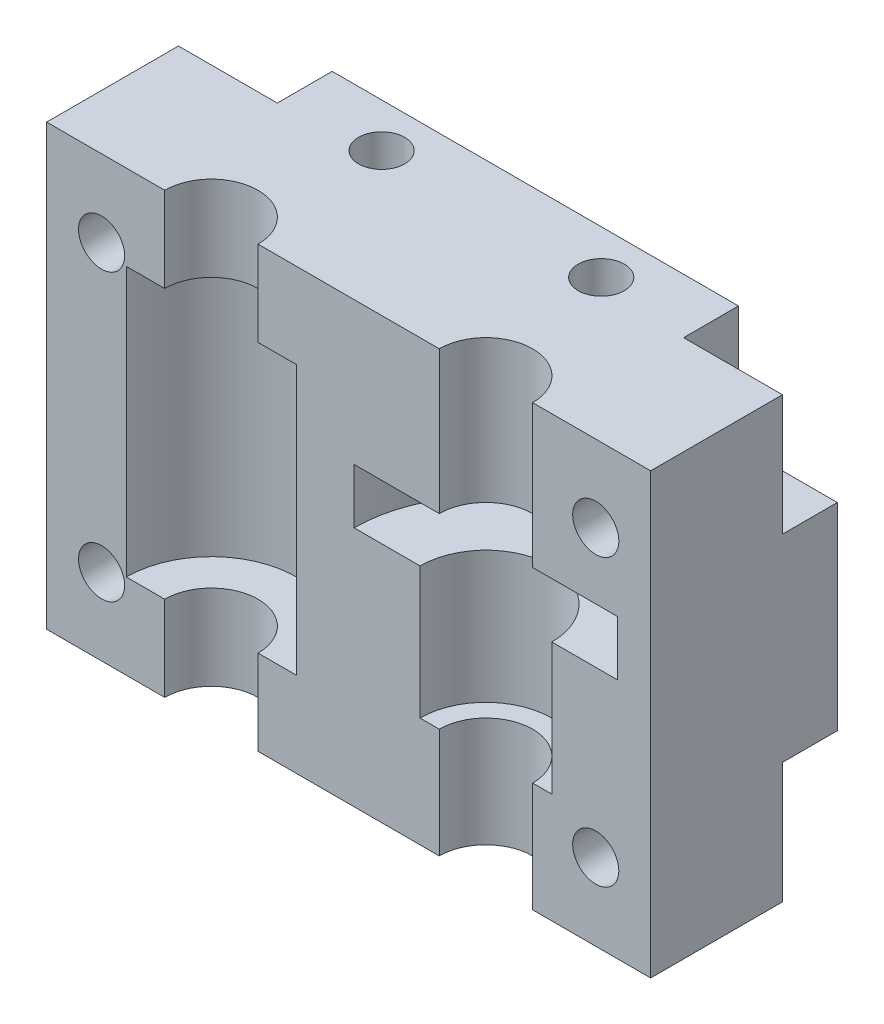
from build123d import *
from build123d.topology import SkipClean

# Parameters (mm, degrees)
ESQUISSE1_W                  = 55
ESQUISSE1_H                  = 45
BOSS_EXTRU_1_DEPTH           = 12
ESQUISSE2_R                  = 4.25
ENL_V_MAT_EXTRU_1_DEPTH      = 55.085580333
ENL_V_MAT_EXTRU_2_DEPTH      = 12.25
ENL_V_MAT_EXTRU_2_DEPTH_BACK = 12.25
ESQUISSE3_R                  = 7.75
ESQUISSE9_W                  = 61.062756781
ESQUISSE9_H                  = 12.22812859
ESQUISSE9_W_2                = 59.427147224
ESQUISSE9_H_2                = 8.100161614
ENL_V_MAT_EXTRU_7_DEPTH      = 31
SKETCH1_W                    = 55
SKETCH1_H                    = 36
BOSS_EXTRUDE1_DEPTH          = 5
SKETCH2_R                    = 2.1
CUT_EXTRUDE1_DEPTH           = 38.003378224
SKETCH3_R                    = 4
CUT_EXTRUDE2_DEPTH           = 10
CUT_EXTRUDE3_DEPTH           = 5
SKETCH5_R                    = 2.1
CUT_EXTRUDE4_DEPTH           = 10
BOSS_EXTRUDE4_START          = 2
SKETCH7_R                    = 2.1
BOSS_EXTRUDE4_DEPTH          = 2
SKETCH8_R                    = 2.1
BOSS_EXTRUDE5_DEPTH          = 2
SKETCH9_W                    = 7
SKETCH9_H                    = 3.2
CUT_EXTRUDE6_DEPTH           = 8
ESQUISSE12_R                 = 6
ENL_V_MAT_EXTRU_9_DEPTH      = 12
ESQUISSE13_R                 = 12
ENL_V_MAT_EXTRU_10_DEPTH     = 5


with BuildPart() as part:
    # Esquisse1 → Boss.-Extru.1 (new body)
    with BuildSketch(Plane.XY):
        Rectangle(ESQUISSE1_W, ESQUISSE1_H)
    extrude(amount=BOSS_EXTRU_1_DEPTH)

    # Esquisse2 → Enlèv. mat.-Extru.1 (cut, through all)
    with BuildSketch(Plane(origin=(0, 22.5, 0), x_dir=(1, 0, 0), z_dir=(0, 1, 0))):
        with Locations((-12.5, -12)):
            Circle(ESQUISSE2_R)
        with Locations((12.5, -12)):
            Circle(ESQUISSE2_R)
    extrude(amount=-ENL_V_MAT_EXTRU_1_DEPTH, mode=Mode.SUBTRACT)

    # Esquisse3 → Enlèv. mat.-Extru.2 (cut, two sides: drawn at the far end of the back side and taken through both)
    with BuildSketch(Plane(origin=(0, 0, 0), x_dir=(1, 0, 0), z_dir=(0, 1, 0)).offset(-ENL_V_MAT_EXTRU_2_DEPTH_BACK)):
        with Locations((-12.5, -12)):
            Circle(ESQUISSE3_R)
    extrude(amount=ENL_V_MAT_EXTRU_2_DEPTH + ENL_V_MAT_EXTRU_2_DEPTH_BACK, mode=Mode.SUBTRACT)

    # Esquisse9 → Enlèv. mat.-Extru.7 (cut)
    with BuildSketch(Plane.XY.offset(12)):
        with Locations((-0.389430846, -24.114064295)):
            Rectangle(ESQUISSE9_W, ESQUISSE9_H)
        with Locations((1.674552641, 22.050080807)):
            Rectangle(ESQUISSE9_W_2, ESQUISSE9_H_2)
    extrude(amount=-ENL_V_MAT_EXTRU_7_DEPTH, mode=Mode.SUBTRACT)

    # Sketch1 → Boss-Extrude1 (add)
    with BuildSketch(Plane(origin=(0, 0, 0), x_dir=(-1, 0, 0), z_dir=(0, 0, -1))):
        Rectangle(SKETCH1_W, SKETCH1_H)
    extrude(amount=BOSS_EXTRUDE1_DEPTH)

    # Sketch2 → Cut-Extrude1 (cut, through all)
    with BuildSketch(Plane.XY.offset(12)):
        with Locations((-22.5, 13)):
            Circle(SKETCH2_R)
        with Locations((22.5, 13)):
            Circle(SKETCH2_R)
        with Locations((22.5, -13)):
            Circle(SKETCH2_R)
        with Locations((-22.5, -13)):
            Circle(SKETCH2_R)
    extrude(amount=-CUT_EXTRUDE1_DEPTH, mode=Mode.SUBTRACT)

    # Sketch3 → Cut-Extrude2 (cut)
    with BuildSketch(Plane(origin=(0, 0, -5), x_dir=(-1, 0, 0), z_dir=(0, 0, -1))):
        with Locations((-22.5, 13)):
            Circle(SKETCH3_R)
        with Locations((22.5, 13)):
            Circle(SKETCH3_R)
        with Locations((22.5, -13)):
            Circle(SKETCH3_R)
        with Locations((-22.5, -13)):
            Circle(SKETCH3_R)
    extrude(amount=-CUT_EXTRUDE2_DEPTH, mode=Mode.SUBTRACT)

    # Sketch4 → Cut-Extrude3 (cut)
    with BuildSketch(Plane(origin=(0, 0, -5), x_dir=(-1, 0, 0), z_dir=(0, 0, -1))):
        with BuildLine():
            Line((-18.5, 13), (-18.5, 18))
            Line((-18.5, 18), (-27.5, 18))
            Line((-27.5, 18), (-27.5, 9))
            Line((-27.5, 9), (-22.5, 9))
            ThreePointArc((-22.5, 9), (-25.328427125, 15.828427125), (-18.5, 13))
        make_face()
        with BuildLine():
            Line((-22.5, -9), (-27.5, -9))
            Line((-27.5, -9), (-27.5, -18))
            Line((-27.5, -18), (-18.5, -18))
            Line((-18.5, -18), (-18.5, -13))
            ThreePointArc((-18.5, -13), (-25.328427125, -15.828427125), (-22.5, -9))
        make_face()
        with BuildLine():
            Line((27.5, -18), (27.5, -9))
            Line((27.5, -9), (22.5, -9))
            ThreePointArc((22.5, -9), (25.328427125, -15.828427125), (18.5, -13))
            Line((18.5, -13), (18.5, -18))
            Line((18.5, -18), (27.5, -18))
        make_face()
        with BuildLine():
            Line((27.5, 18), (18.5, 18))
            Line((18.5, 18), (18.5, 13))
            ThreePointArc((18.5, 13), (25.328427125, 15.828427125), (22.5, 9))
            Line((22.5, 9), (27.5, 9))
            Line((27.5, 9), (27.5, 18))
        make_face()
    extrude(amount=-CUT_EXTRUDE3_DEPTH, mode=Mode.SUBTRACT)

    # Sketch5 → Cut-Extrude4 (cut)
    with BuildSketch(Plane(origin=(0, 18, 0), x_dir=(1, 0, 0), z_dir=(0, 1, 0))):
        with Locations((-10, 1)):
            Circle(SKETCH5_R)
        with Locations((10, 1)):
            Circle(SKETCH5_R)
    extrude(amount=-CUT_EXTRUDE4_DEPTH, mode=Mode.SUBTRACT)

    # Sketch7 → Boss-Extrude4 (add)
    with SkipClean():  # the faces are left unmerged after this step: merging them gives an invalid solid
        with BuildSketch(Plane(origin=(0, 18, 0), x_dir=(1, 0, 0), z_dir=(0, 1, 0)).offset(BOSS_EXTRUDE4_START)):
            with BuildLine():
                Line((18.5, 5), (-18.5, 5))
                Line((-18.5, 5), (-18.5, 0))
                Line((-18.5, 0), (-27.5, 0))
                Line((-27.5, 0), (-27.5, -12))
                Line((-27.5, -12), (-16.75, -12))
                ThreePointArc((-16.75, -12), (-12.5, -7.75), (-8.25, -12))
                Line((-8.25, -12), (8.25, -12))
                ThreePointArc((8.25, -12), (12.5, -7.75), (16.75, -12))
                Line((16.75, -12), (27.5, -12))
                Line((27.5, -12), (27.5, 0))
                Line((27.5, 0), (18.5, 0))
                Line((18.5, 0), (18.5, 5))
            make_face()
            with Locations((10, 1)):
                Circle(SKETCH7_R, mode=Mode.SUBTRACT)
            with Locations((-10, 1)):
                Circle(SKETCH7_R, mode=Mode.SUBTRACT)
        extrude(amount=-BOSS_EXTRUDE4_DEPTH)
    add(part.part.scale(1), mode=Mode.REPLACE)  # the faces are merged on a copy

    # Sketch8 → Boss-Extrude5 (add)
    with BuildSketch(Plane.XZ.offset(18)):
        with BuildLine():
            Line((-27.5, 0), (-18.5, 0))
            Line((-18.5, 0), (-18.5, -5))
            Line((-18.5, -5), (18.5, -5))
            Line((18.5, -5), (18.5, 0))
            Line((18.5, 0), (27.5, 0))
            Line((27.5, 0), (27.5, 12))
            Line((27.5, 12), (16.75, 12))
            ThreePointArc((16.75, 12), (12.5, 7.75), (8.25, 12))
            Line((8.25, 12), (-8.25, 12))
            ThreePointArc((-8.25, 12), (-12.5, 7.75), (-16.75, 12))
            Line((-16.75, 12), (-27.5, 12))
            Line((-27.5, 12), (-27.5, 0))
        make_face()
        with Locations((10, -1)):
            Circle(SKETCH8_R, mode=Mode.SUBTRACT)
        with Locations((-10, -1)):
            Circle(SKETCH8_R, mode=Mode.SUBTRACT)
    extrude(amount=BOSS_EXTRUDE5_DEPTH)

    # Sketch9 → Cut-Extrude6 (cut)
    with BuildSketch(Plane(origin=(0, 0, -5), x_dir=(-1, 0, 0), z_dir=(0, 0, -1))):
        with Locations((-10, 14.4)):
            Rectangle(SKETCH9_W, SKETCH9_H)
        with Locations((10, 14.4)):
            Rectangle(SKETCH9_W, SKETCH9_H)
        with Locations((10, -14.4)):
            Rectangle(SKETCH9_W, SKETCH9_H)
        with Locations((-10, -14.4)):
            Rectangle(SKETCH9_W, SKETCH9_H)
    extrude(amount=-CUT_EXTRUDE6_DEPTH, mode=Mode.SUBTRACT)

    # Esquisse12 → Enlèv. mat.-Extru.9 (cut)
    with BuildSketch(Plane(origin=(0, 2, 0), x_dir=(-1, 0, 0), z_dir=(0, -1, 0))):
        with Locations((-12.5, -12)):
            Circle(ESQUISSE12_R)
    extrude(amount=ENL_V_MAT_EXTRU_9_DEPTH, mode=Mode.SUBTRACT)

    # Esquisse13 → Enlèv. mat.-Extru.10 (cut)
    with BuildSketch(Plane(origin=(0, 2, 0), x_dir=(-1, 0, 0), z_dir=(0, -1, 0))):
        with Locations((-12.5, -12)):
            Circle(ESQUISSE13_R)
    extrude(amount=-ENL_V_MAT_EXTRU_10_DEPTH, mode=Mode.SUBTRACT)


solid = part.part
